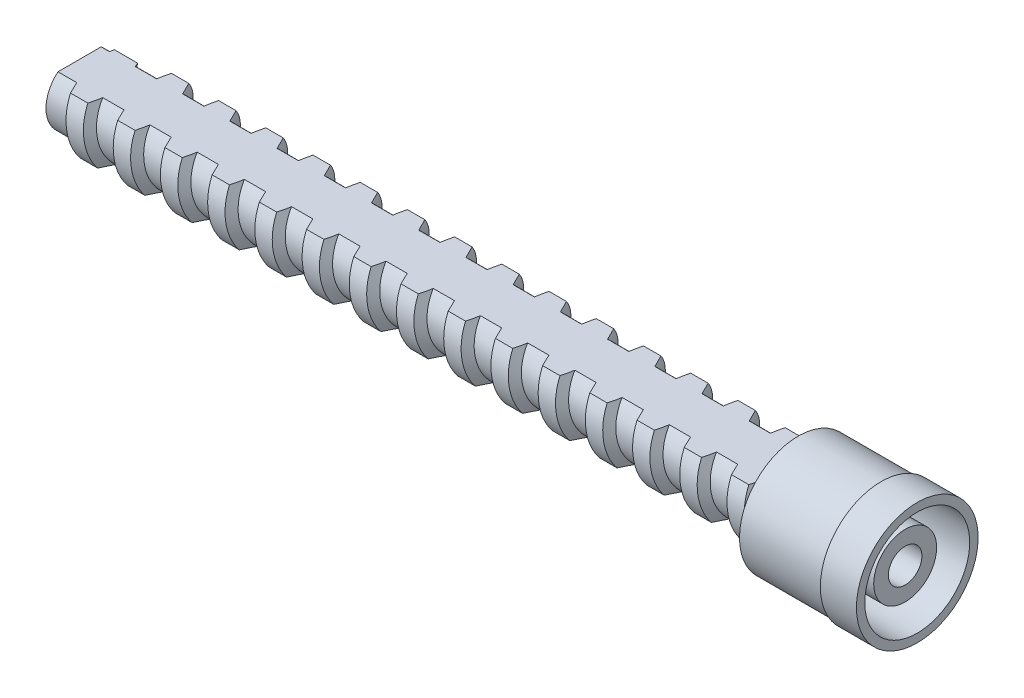
from build123d import *

# Parameters (mm, degrees)
VARREDURA2_PITCH      = 2.25
ESBO_O6_OUTSIDE_W     = 15.952
ESBO_O6_OUTSIDE_H     = 15.952
ESBO_O6_OUTSIDE_W_2   = 4.767664613
ESBO_O6_OUTSIDE_H_2   = 2.45
CORTE_EXTRUS_O2_DEPTH = 34.25


with BuildPart() as part:
    # Esboço1 → Revolução1 (revolve)
    with BuildSketch(Plane.XY, mode=Mode.PRIVATE) as revolu_o1_sk:
        Polygon((0, 1.6), (34.25, 1.6), (34.25, 2.8), (38.201998766, 2.8), (38.201998766, 2.9), (39.921494273, 2.9), (39.921494273, 2.5), (34.570711745, 2.5), (34.570711745, 1.5), (39.344178783, 1.5), (39.344178783, 0.8), (35.360914059, 0.8), (35.360914059, 0), (0, 0), align=None)
    revolve(revolu_o1_sk.sketch.rotate(Axis((0, 0, 0), (1, 0, 0)), 90), axis=Axis((0, 0, 0), (1, 0, 0)))

    # Varredura2: arcs per turn and ends read off the stored shape
    # Varredura2: the profile of Esboço5 screwed along a right-hand helix through 15 turns, 10 arcs to a turn; built about Z, then put on its axis
    varredura2_z = Axis((0, 0, 0), (0, 0, 1))
    varredura2_corners = [(1.575881798, -2.75e-07, 0.353463765), (2.022619988, -3.53e-07, 0.564540364), (2.022619988, -3.53e-07, 1.392387167), (1.599007939, -2.79e-07, 1.603463765), (1.240171629, -2.16e-07, 1.603463765), (1.240171629, -2.16e-07, 0.353463765)]
    with BuildLine(mode=Mode.PRIVATE) as varredura2_profile:
        Line(varredura2_corners[0], varredura2_corners[1])
        Line(varredura2_corners[1], varredura2_corners[2])
        Line(varredura2_corners[2], varredura2_corners[3])
        Line(varredura2_corners[3], varredura2_corners[4])
        Line(varredura2_corners[4], varredura2_corners[5])
        Line(varredura2_corners[5], varredura2_corners[0])
    varredura2_cap = Face(varredura2_profile.wire())
    varredura2_turn_angles = [0, 18, 36, 54, 72, 90, 108, 126, 144, 162, 180, 198, 216, 234, 252, 270, 288, 306, 324, 342, 360]
    varredura2_turn_weights = [1, 0.9510565162951535, 1, 0.9510565162951535, 1, 0.9510565162951535, 1, 0.9510565162951535, 1, 0.9510565162951535, 1, 0.9510565162951535, 1, 0.9510565162951535, 1, 0.9510565162951535, 1, 0.9510565162951535, 1, 0.9510565162951535, 1]
    varredura2_turn_rails = [Edge.make_bspline([Vector(p[0], p[1], 0).rotate(varredura2_z, varredura2_turn_angles[k]) / varredura2_turn_weights[k] + Vector(0, 0, p[2] + VARREDURA2_PITCH * varredura2_turn_angles[k] / 360) for k in range(21)], [0, 0, 0, 1, 1, 2, 2, 3, 3, 4, 4, 5, 5, 6, 6, 7, 7, 8, 8, 9, 9, 10, 10, 10], 2, varredura2_turn_weights) for p in varredura2_corners]
    varredura2_turn_sides = [Face.make_surface_from_curves(varredura2_turn_rails[p[0]], varredura2_turn_rails[p[1]]) for p in [(0, 1), (1, 2), (2, 3), (3, 4), (4, 5), (5, 0)]]
    varredura2 = Plane(origin=(0, 0, 0), x_dir=(0, 0.7071067811865438, -0.7071067811865512), z_dir=(1, 0, 0)) * Solid(Shell([*[p.moved(Location((0, 0, VARREDURA2_PITCH * i))) for i in range(15) for p in varredura2_turn_sides], varredura2_cap, varredura2_cap.rotate(varredura2_z, 5400).moved(Location((0, 0, VARREDURA2_PITCH * 5400 / 360)))]))
    add(varredura2)

    # Esboço6 outside → Corte-extrusão2 (cut)
    with BuildSketch(Plane(origin=(0, 0, 0), x_dir=(0, 0, -1), z_dir=(1, 0, 0))):
        Rectangle(ESBO_O6_OUTSIDE_W, ESBO_O6_OUTSIDE_H)
        with Locations((0.106394325, 0)):
            Rectangle(ESBO_O6_OUTSIDE_W_2, ESBO_O6_OUTSIDE_H_2, mode=Mode.SUBTRACT)
    extrude(amount=CORTE_EXTRUS_O2_DEPTH, mode=Mode.SUBTRACT)


solid = part.part
